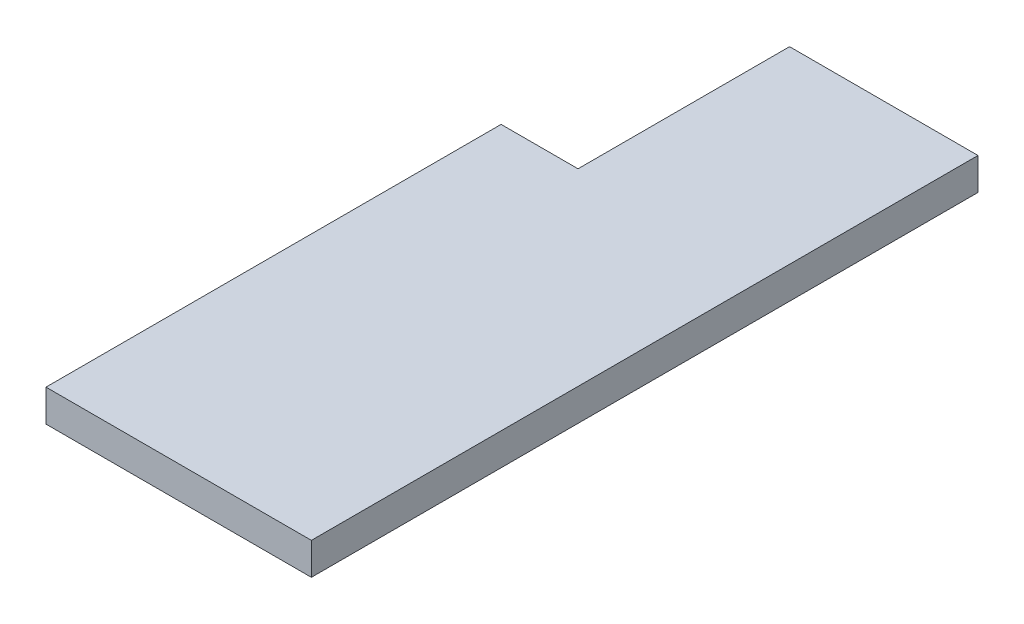
from build123d import *

# Parameters (mm, degrees)
SKETCH1_W           = 53.594
SKETCH1_H           = 82.55
BOSS_EXTRUDE1_DEPTH = 6.35
SKETCH6_W           = 53.594
SKETCH6_H           = 6.35
BOSS_EXTRUDE3_DEPTH = 7.62
CUT_EXTRUDE2_REACH  = 100.626
SKETCH3_W           = 0.508
SKETCH3_H           = 90.17
SKETCH8_W           = 37.338
SKETCH8_H           = 6.35
BOSS_EXTRUDE4_DEPTH = 41.91


with BuildPart() as part:
    # Sketch1 → Boss-Extrude1 (new body)
    with BuildSketch(Plane(origin=(0, 0, 0), x_dir=(1, 0, 0), z_dir=(0, 1, 0))):
        with Locations((-26.797, 41.275)):
            Rectangle(SKETCH1_W, SKETCH1_H)
    extrude(amount=BOSS_EXTRUDE1_DEPTH)

    # Sketch6 → Boss-Extrude3 (add)
    with BuildSketch(Plane.XY):
        with Locations((-26.797, 3.175)):
            Rectangle(SKETCH6_W, SKETCH6_H)
    extrude(amount=BOSS_EXTRUDE3_DEPTH)

    # Sketch3 → Cut-Extrude2 (cut, up to next)
    with BuildSketch(Plane(origin=(0, 6.35, 0), x_dir=(1, 0, 0), z_dir=(0, 1, 0)), mode=Mode.PRIVATE) as cut_extrude2_sk1:
        with Locations((-0.254, 37.465)):
            Rectangle(SKETCH3_W, SKETCH3_H)
    cut_extrude2_tool1 = extrude(cut_extrude2_sk1.sketch, amount=-CUT_EXTRUDE2_REACH, mode=Mode.PRIVATE) & part.part
    cut_extrude2 = cut_extrude2_tool1.solids().sort_by_distance((-0.254, 6.35, -37.465))[0]
    add(cut_extrude2, mode=Mode.SUBTRACT)

    # Mirror1: Cut-Extrude2 across plane
    add(cut_extrude2.mirror(Plane(origin=(-26.797, 0, 0), x_dir=(0, 0, 1), z_dir=(1, 0, 0))), mode=Mode.SUBTRACT)

    # Sketch8 → Boss-Extrude4 (add)
    with BuildSketch(Plane(origin=(0, 0, -82.55), x_dir=(-1, 0, 0), z_dir=(0, 0, -1))):
        with Locations((19.177, 3.175)):
            Rectangle(SKETCH8_W, SKETCH8_H)
    extrude(amount=BOSS_EXTRUDE4_DEPTH)


solid = part.part
